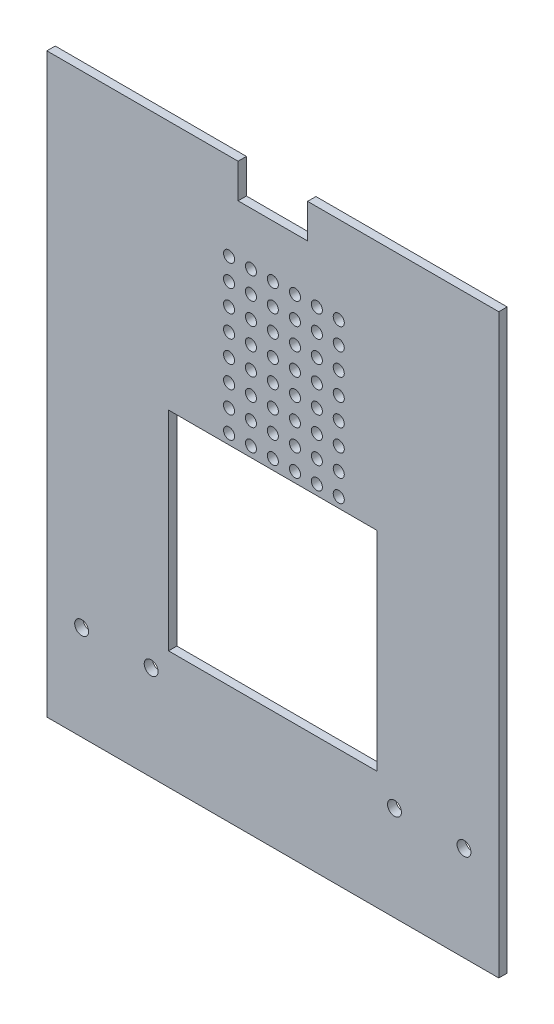
from build123d import *

# Parameters (mm, degrees)
SKETCH1_W           = 165.1
SKETCH1_H           = 292.1
BOSS_EXTRUDE1_DEPTH = 3.048
SKETCH2_W           = 76.2
SKETCH2_H           = 76.2
SKETCH2_R           = 2.0193
CUT_EXTRUDE1_DEPTH  = 168.792715289
CUT_EXTRUDE2_DEPTH  = 168.792715289
SKETCH5_R           = 2.54
CUT_EXTRUDE3_DEPTH  = 168.792715289
SKETCH6_W           = 165.1
SKETCH6_H           = 5.08
CUT_EXTRUDE4_DEPTH  = 168.792715289


with BuildPart() as part:
    # Sketch1 → Boss-Extrude1 (new body)
    with BuildSketch(Plane.XY):
        Rectangle(SKETCH1_W, SKETCH1_H)
    extrude(amount=BOSS_EXTRUDE1_DEPTH)

    # Sketch2 → Cut-Extrude1 (cut, through all)
    with BuildSketch(Plane.XY):
        with BuildLine():
            Line((8.086894284, 99.764589505), (8.086894284, 109.0549))
            Line((8.086894284, 109.0549), (-8.086894284, 109.0549))
            Line((-8.086894284, 109.0549), (-8.086894284, 99.764589505))
            ThreePointArc((-8.086894284, 99.764589505), (-10.7315, 92.71), (-8.086894284, 85.655410495))
            Line((-8.086894284, 85.655410495), (-8.086894284, 76.3651))
            Line((-8.086894284, 76.3651), (8.086894284, 76.3651))
            Line((8.086894284, 76.3651), (8.086894284, 85.655410495))
            ThreePointArc((8.086894284, 85.655410495), (10.7315, 92.71), (8.086894284, 99.764589505))
        make_face()
        with Locations((0, -59.69)):
            Rectangle(SKETCH2_W, SKETCH2_H)
        with Locations((0, 38.1)):
            Circle(SKETCH2_R)
        with Locations((0, 30.1)):
            Circle(SKETCH2_R)
        with Locations((0, 22.1)):
            Circle(SKETCH2_R)
        with Locations((0, 14.1)):
            Circle(SKETCH2_R)
        with Locations((0, 6.1)):
            Circle(SKETCH2_R)
        with Locations((0, -1.9)):
            Circle(SKETCH2_R)
        with Locations((0, -9.9)):
            Circle(SKETCH2_R)
        with Locations((0, -17.9)):
            Circle(SKETCH2_R)
        with Locations((-8, 38.1)):
            Circle(SKETCH2_R)
        with Locations((-16, 38.1)):
            Circle(SKETCH2_R)
        with Locations((-8, 30.1)):
            Circle(SKETCH2_R)
        with Locations((-16, 30.1)):
            Circle(SKETCH2_R)
        with Locations((-8, 22.1)):
            Circle(SKETCH2_R)
        with Locations((-16, 22.1)):
            Circle(SKETCH2_R)
        with Locations((-8, 14.1)):
            Circle(SKETCH2_R)
        with Locations((-16, 14.1)):
            Circle(SKETCH2_R)
        with Locations((-8, 6.1)):
            Circle(SKETCH2_R)
        with Locations((-16, 6.1)):
            Circle(SKETCH2_R)
        with Locations((-8, -1.9)):
            Circle(SKETCH2_R)
        with Locations((-16, -1.9)):
            Circle(SKETCH2_R)
        with Locations((-8, -9.9)):
            Circle(SKETCH2_R)
        with Locations((-16, -9.9)):
            Circle(SKETCH2_R)
        with Locations((-8, -17.9)):
            Circle(SKETCH2_R)
        with Locations((-16, -17.9)):
            Circle(SKETCH2_R)
        with Locations((24.086894284, 14.1)):
            Circle(SKETCH2_R)
        with Locations((8.086894284, 14.1)):
            Circle(SKETCH2_R)
        with Locations((8.086894284, -17.9)):
            Circle(SKETCH2_R)
        with Locations((24.086894284, 6.1)):
            Circle(SKETCH2_R)
        with Locations((16.086894284, 6.1)):
            Circle(SKETCH2_R)
        with Locations((8.086894284, -1.9)):
            Circle(SKETCH2_R)
        with Locations((8.086894284, 30.1)):
            Circle(SKETCH2_R)
        with Locations((24.086894284, 22.1)):
            Circle(SKETCH2_R)
        with Locations((24.086894284, -1.9)):
            Circle(SKETCH2_R)
        with Locations((24.086894284, -9.9)):
            Circle(SKETCH2_R)
        with Locations((8.086894284, 6.1)):
            Circle(SKETCH2_R)
        with Locations((16.086894284, 22.1)):
            Circle(SKETCH2_R)
        with Locations((8.086894284, 22.1)):
            Circle(SKETCH2_R)
        with Locations((8.086894284, -9.9)):
            Circle(SKETCH2_R)
        with Locations((24.086894284, -17.9)):
            Circle(SKETCH2_R)
        with Locations((16.086894284, 14.1)):
            Circle(SKETCH2_R)
        with Locations((16.086894284, -17.9)):
            Circle(SKETCH2_R)
        with Locations((16.086894284, 30.1)):
            Circle(SKETCH2_R)
        with Locations((24.086894284, 30.1)):
            Circle(SKETCH2_R)
        with Locations((16.086894284, -9.9)):
            Circle(SKETCH2_R)
        with Locations((16.086894284, -1.9)):
            Circle(SKETCH2_R)
        with Locations((16.086894284, 38.1)):
            Circle(SKETCH2_R)
        with Locations((8.086894284, 38.1)):
            Circle(SKETCH2_R)
        with Locations((24.086894284, 38.1)):
            Circle(SKETCH2_R)
    extrude(amount=CUT_EXTRUDE1_DEPTH, mode=Mode.SUBTRACT)

    # Sketch4 → Cut-Extrude2 (cut, through all)
    with BuildSketch(Plane.XY):
        Polygon((-12.7, 57.310847547), (-12.7, 69.85), (-82.55, 69.85), (-82.55, 146.05), (82.55, 146.05), (82.55, 69.85), (12.7, 69.85), (12.7, 57.310847547), align=None)
    extrude(amount=CUT_EXTRUDE2_DEPTH, mode=Mode.SUBTRACT)

    # Sketch5 → Cut-Extrude3 (cut, through all)
    with BuildSketch(Plane(origin=(0, 0, 0), x_dir=(-1, 0, 0), z_dir=(0, 0, -1))):
        with Locations((-44.45, -106.299)):
            Circle(SKETCH5_R)
        with Locations((-69.85, -106.299)):
            Circle(SKETCH5_R)
        with Locations((69.85, -106.299)):
            Circle(SKETCH5_R)
        with Locations((44.45, -106.299)):
            Circle(SKETCH5_R)
    extrude(amount=-CUT_EXTRUDE3_DEPTH, mode=Mode.SUBTRACT)

    # Sketch6 → Cut-Extrude4 (cut, through all)
    with BuildSketch(Plane(origin=(0, 0, 0), x_dir=(-1, 0, 0), z_dir=(0, 0, -1))):
        with Locations((0, -143.51)):
            Rectangle(SKETCH6_W, SKETCH6_H)
    extrude(amount=-CUT_EXTRUDE4_DEPTH, mode=Mode.SUBTRACT)


solid = part.part
